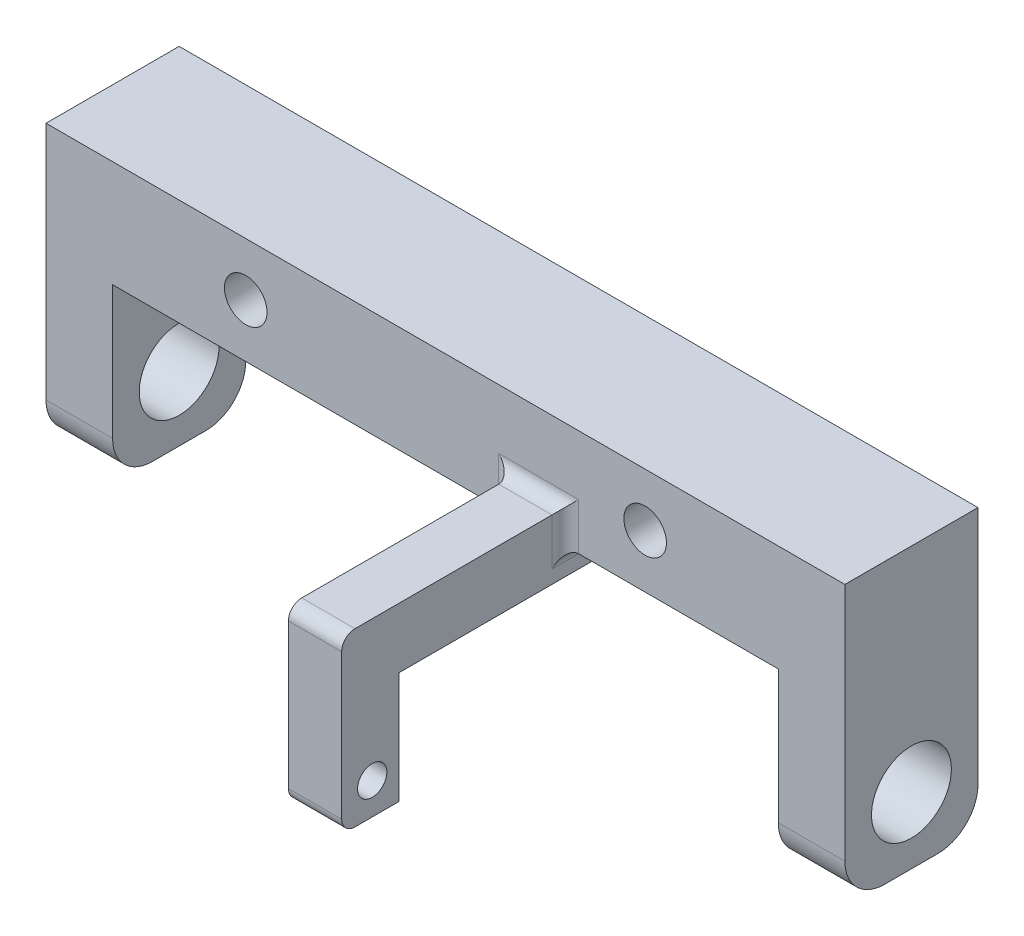
from build123d import *

# Parameters (mm, degrees)
SKETCH_1_W               = 60
SKETCH_1_H               = 10
EXTRUDE_1_DEPTH          = 8
SKETCH_2_W               = 10
SKETCH_2_H               = 21
SKETCH_2_R               = 3
EXTRUDE_2_DEPTH          = 5
FILLET_1_R               = 3
SKETCH_3_R               = 1.1
EXTRUDE_3_DEPTH          = 4
FILLET_4_R               = 1
CUT_EXTRUDE_1_DEPTH      = 37.755985178
CUT_EXTRUDE_1_DEPTH_BACK = 37.755985178
SKETCH_4_R               = 1.6


with BuildPart() as part:
    # 草图1 → 凸台-拉伸1 (new body)
    with BuildSketch(Plane(origin=(0, 0, 0), x_dir=(1, 0, 0), z_dir=(0, 1, 0))):
        Rectangle(SKETCH_1_W, SKETCH_1_H)
    extrude(amount=EXTRUDE_1_DEPTH)

    # 草图2 → 凸台-拉伸2 (add)
    with BuildSketch(Plane(origin=(30, 0, 0), x_dir=(0, 0, -1), z_dir=(1, 0, 0))):
        with Locations((0, -2.5)):
            Rectangle(SKETCH_2_W, SKETCH_2_H)
        with Locations((0, -8)):
            Circle(SKETCH_2_R, mode=Mode.SUBTRACT)
    extrude_2 = extrude(amount=-EXTRUDE_2_DEPTH)

    # 镜向1: 凸台-拉伸2 across plane
    add(extrude_2.mirror(Plane(origin=(0, 0, 0), x_dir=(0, 0, 1), z_dir=(1, 0, 0))))

    # 圆角1
    fillet_1_edges = [part.edges().sort_by_distance(p)[0] for p in [
        (-27.5, -13, -5),
        (-27.5, -13, 5),
        (27.5, -13, -5),
        (27.5, -13, 5),
    ]]
    fillet(fillet_1_edges, radius=FILLET_1_R)

    # 草图3 → 凸台-拉伸3 (add)
    with BuildSketch(Plane.ZY.offset(-5)):
        Polygon((-6.5, -2), (17.5, -2), (17.5, -8), (17.5, -10.376383694), (21.792928464, -10.376383694), (21.792928464, 2.519827065), (-10.892331711, 2.519827065), (-10.892331711, -10.376383694), (-6.5, -10.376383694), (-6.5, -8), align=None)
        with Locations((-8.5, -8)):
            Circle(SKETCH_3_R, mode=Mode.SUBTRACT)
        with Locations((19.5, -8)):
            Circle(SKETCH_3_R, mode=Mode.SUBTRACT)
    extrude(amount=-EXTRUDE_3_DEPTH)

    # 圆角4
    fillet_4_edges = [part.edges().sort_by_distance(p)[0] for p in [
        (9, 0, 0),
        (5, 0, 0),
        (5, 1.259913532, -5),
        (9, 1.259913532, -5),
        (9, 1.259913532, 5),
        (7, 2.519827065, 21.792928464),
        (7, -10.376383694, 21.792928464),
        (7, -10.376383694, -10.892331711),
        (7, 2.519827065, -10.892331711),
        (7, 2.519827065, -5),
        (7, 2.519827065, 5),
        (5, 1.259913532, 5),
    ]]
    fillet(fillet_4_edges, radius=FILLET_4_R)

    # 草图4 → 切除-拉伸1 (cut, two sides: drawn at the far end of the back side and taken through both)
    with BuildSketch(Plane.XY.offset(5).offset(-CUT_EXTRUDE_1_DEPTH_BACK)):
        with Locations((-15, 4)):
            Circle(SKETCH_4_R)
        with Locations((15, 4)):
            Circle(SKETCH_4_R)
    extrude(amount=CUT_EXTRUDE_1_DEPTH + CUT_EXTRUDE_1_DEPTH_BACK, mode=Mode.SUBTRACT)


solid = part.part
